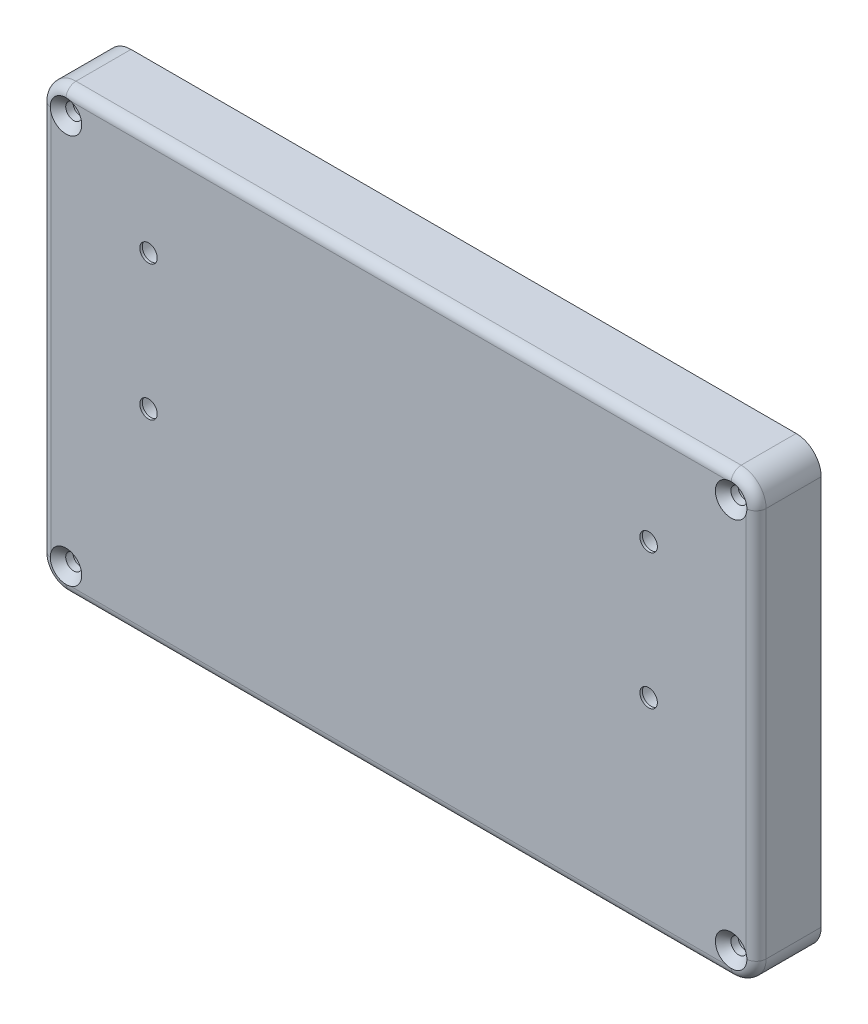
from build123d import *

# Parameters (mm, degrees)
BOSS_EXTRUDE1_DEPTH                             = 3
BOSS_EXTRUDE2_START                             = 10
SKETCH2_R                                       = 2
BOSS_EXTRUDE2_DEPTH                             = 10
FILLET2_R                                       = 2
CSK_FOR_M3_FLAT_HEAD_MACHINE_SCREW1_D           = 3.2
CSK_FOR_M3_FLAT_HEAD_MACHINE_SCREW1_CSINK_D     = 6.3
CSK_FOR_M3_FLAT_HEAD_MACHINE_SCREW1_CSINK_ANGLE = 90
BOSS_EXTRUDE3_DEPTH                             = 2
BOSS_EXTRUDE3_DEPTH_BACK                        = 4
SKETCH5_W                                       = 113
SKETCH5_H                                       = 2
SKETCH5_W_2                                     = 2
SKETCH5_H_2                                     = 58
CHAMFER1_SIZE                                   = 2
CHAMFER2_SIZE                                   = 0.5
SKETCH6_R                                       = 1.75
CUT_EXTRUDE1_DEPTH                              = 86.283351383
SKETCH7_R                                       = 4
SKETCH7_R_2                                     = 2.75
BOSS_EXTRUDE4_DEPTH                             = 1.5
CUT_EXTRUDE2_START                              = -4
SKETCH8_R                                       = 2.75
CUT_EXTRUDE2_DEPTH                              = 4


with BuildPart() as part:
    # Sketch1 → Boss-Extrude1 (new body)
    with BuildSketch(Plane.XY):
        with BuildLine():
            Line((-66.5, 44), (66.5, 44))
            ThreePointArc((66.5, 44), (70.035533906, 42.535533906), (71.5, 39))
            Line((71.5, 39), (71.5, -39))
            ThreePointArc((71.5, -39), (70.035533906, -42.535533906), (66.5, -44))
            Line((66.5, -44), (-66.5, -44))
            ThreePointArc((-66.5, -44), (-70.035533906, -42.535533906), (-71.5, -39))
            Line((-71.5, -39), (-71.5, 39))
            ThreePointArc((-71.5, 39), (-70.035533906, 42.535533906), (-66.5, 44))
        make_face()
    extrude(amount=BOSS_EXTRUDE1_DEPTH)

    # Sketch2 → Boss-Extrude2 (add)
    with BuildSketch(Plane(origin=(0, 0, 0), x_dir=(-1, 0, 0), z_dir=(0, 0, -1)).offset(BOSS_EXTRUDE2_START)):
        with BuildLine():
            Line((-66.5, 44), (66.5, 44))
            ThreePointArc((66.5, 44), (70.035533906, 42.535533906), (71.5, 39))
            Line((71.5, 39), (71.5, -39))
            ThreePointArc((71.5, -39), (70.035533906, -42.535533906), (66.5, -44))
            Line((66.5, -44), (-66.5, -44))
            ThreePointArc((-66.5, -44), (-70.035533906, -42.535533906), (-71.5, -39))
            Line((-71.5, -39), (-71.5, 39))
            ThreePointArc((-71.5, 39), (-70.035533906, 42.535533906), (-66.5, 44))
        make_face()
        with Locations((-66.5, 39)):
            Circle(SKETCH2_R, mode=Mode.SUBTRACT)
        with Locations(Location((66.5, 39, 0), (0, 0, 180))):
            Circle(SKETCH2_R, mode=Mode.SUBTRACT)
        with Locations((66.5, -39)):
            Circle(SKETCH2_R, mode=Mode.SUBTRACT)
        with Locations(Location((-66.5, -39, 0), (0, 0, 180))):
            Circle(SKETCH2_R, mode=Mode.SUBTRACT)
        with BuildLine():
            Line((-61.917424305, 41), (61.917424305, 41))
            Line((61.917424305, 41), (61.917424305, 37))
            ThreePointArc((61.917424305, 37), (64.673843213, 34.345416088), (68.5, 34.417424305))
            Line((68.5, 34.417424305), (68.5, -34.417424305))
            ThreePointArc((68.5, -34.417424305), (64.673843213, -34.345416088), (61.917424305, -37))
            Line((61.917424305, -37), (61.917424305, -41))
            Line((61.917424305, -41), (-61.917424305, -41))
            ThreePointArc((-61.917424305, -41), (-62.964466094, -35.464466094), (-68.5, -34.417424305))
            Line((-68.5, -34.417424305), (-68.5, 34.417424305))
            ThreePointArc((-68.5, 34.417424305), (-62.964466094, 35.464466094), (-61.917424305, 41))
        make_face(mode=Mode.SUBTRACT)
    extrude(amount=-BOSS_EXTRUDE2_DEPTH)

    # Fillet2
    fillet2_edges = [part.edges().sort_by_distance(p)[0] for p in [
        (-70.035533906, -42.535533906, 3),
        (0, -44, 3),
        (70.035533906, -42.535533906, 3),
        (71.5, 0, 3),
        (70.035533906, 42.535533906, 3),
        (0, 44, 3),
        (0, 41, 0),
        (68.5, 0, 0),
        (0, -41, 0),
        (-68.5, 0, 0),
        (-70.035533906, 42.535533906, 3),
        (-71.5, 0, 3),
    ]]
    fillet(fillet2_edges, radius=FILLET2_R)

    # CSK for M3 Flat Head Machine Screw1 (through all)
    with Locations(Plane.XY.offset(3)):
        with Locations((-66.5, 39), (66.5, 39), (66.5, -39), (-66.5, -39)):
            CounterSinkHole(CSK_FOR_M3_FLAT_HEAD_MACHINE_SCREW1_D / 2, CSK_FOR_M3_FLAT_HEAD_MACHINE_SCREW1_CSINK_D / 2, counter_sink_angle=CSK_FOR_M3_FLAT_HEAD_MACHINE_SCREW1_CSINK_ANGLE)

    # Sketch5 → Boss-Extrude3 (add, two sides: drawn at the far end of the back side and taken through both)
    with BuildSketch(Plane(origin=(0, 0, -10), x_dir=(-1, 0, 0), z_dir=(0, 0, -1)).offset(-BOSS_EXTRUDE3_DEPTH_BACK)):
        with Locations((0, 40)):
            Rectangle(SKETCH5_W, SKETCH5_H)
        with Locations((-67.5, 0)):
            Rectangle(SKETCH5_W_2, SKETCH5_H_2)
        with Locations((0, -40)):
            Rectangle(SKETCH5_W, SKETCH5_H)
        with Locations((67.5, 0)):
            Rectangle(SKETCH5_W_2, SKETCH5_H_2)
    extrude(amount=BOSS_EXTRUDE3_DEPTH + BOSS_EXTRUDE3_DEPTH_BACK)

    # Chamfer1
    chamfer1_edges = [part.edges().sort_by_distance(p)[0] for p in [
        (0, -39, -6),
        (-66.5, 0, -6),
        (66.5, 0, -6),
        (0, 39, -6),
    ]]
    chamfer(chamfer1_edges, length=CHAMFER1_SIZE - 0.0001)  # a hair under: the kernel refuses the full size

    # Chamfer2
    chamfer2_edges = [part.edges().sort_by_distance(p)[0] for p in [
        (0, 41, -12),
        (68.5, 0, -12),
        (0, -41, -12),
        (-68.5, 0, -12),
    ]]
    chamfer(chamfer2_edges, length=CHAMFER2_SIZE)

    # Sketch6 → Cut-Extrude1 (cut, through all)
    with BuildSketch(Plane.XY.offset(3)):
        with Locations((-50, 23.5)):
            Circle(SKETCH6_R)
        with Locations((-50, -3.5)):
            Circle(SKETCH6_R)
        with Locations((50, -3.5)):
            Circle(SKETCH6_R)
        with Locations((50, 23.5)):
            Circle(SKETCH6_R)
    extrude(amount=-CUT_EXTRUDE1_DEPTH, mode=Mode.SUBTRACT)

    # Sketch7 → Boss-Extrude4 (add)
    # profile 1 of 4: a face of its own
    with BuildSketch(Plane(origin=(0, 0, 0), x_dir=(-1, 0, 0), z_dir=(0, 0, -1))):
        with Locations(Location((-50, 23.5, 0), (0, 0, 180))):
            Circle(SKETCH7_R)
        with Locations((-50, 23.5)):
            Circle(SKETCH7_R_2, mode=Mode.SUBTRACT)
    # profile 2 of 4: a face of its own
    with BuildSketch(Plane(origin=(0, 0, 0), x_dir=(-1, 0, 0), z_dir=(0, 0, -1))):
        with Locations(Location((-50, -3.5, 0), (0, 0, 180))):
            Circle(SKETCH7_R)
        with Locations((-50, -3.5)):
            Circle(SKETCH7_R_2, mode=Mode.SUBTRACT)
    # profile 3 of 4: a face of its own
    with BuildSketch(Plane(origin=(0, 0, 0), x_dir=(-1, 0, 0), z_dir=(0, 0, -1))):
        with Locations(Location((50, -3.5, 0), (0, 0, 180))):
            Circle(SKETCH7_R)
        with Locations((50, -3.5)):
            Circle(SKETCH7_R_2, mode=Mode.SUBTRACT)
    # profile 4 of 4: a face of its own
    with BuildSketch(Plane(origin=(0, 0, 0), x_dir=(-1, 0, 0), z_dir=(0, 0, -1))):
        with Locations(Location((50, 23.5, 0), (0, 0, 180))):
            Circle(SKETCH7_R)
        with Locations((50, 23.5)):
            Circle(SKETCH7_R_2, mode=Mode.SUBTRACT)
    extrude(amount=BOSS_EXTRUDE4_DEPTH)

    # Sketch8 → Cut-Extrude2 (cut)
    with BuildSketch(Plane(origin=(0, 0, -1.5), x_dir=(-1, 0, 0), z_dir=(0, 0, -1)).offset(CUT_EXTRUDE2_START)):
        with Locations((-50, 23.5)):
            Circle(SKETCH8_R)
        with Locations((-50, -3.5)):
            Circle(SKETCH8_R)
        with Locations((50, -3.5)):
            Circle(SKETCH8_R)
        with Locations((50, 23.5)):
            Circle(SKETCH8_R)
    extrude(amount=CUT_EXTRUDE2_DEPTH, mode=Mode.SUBTRACT)


solid = part.part
